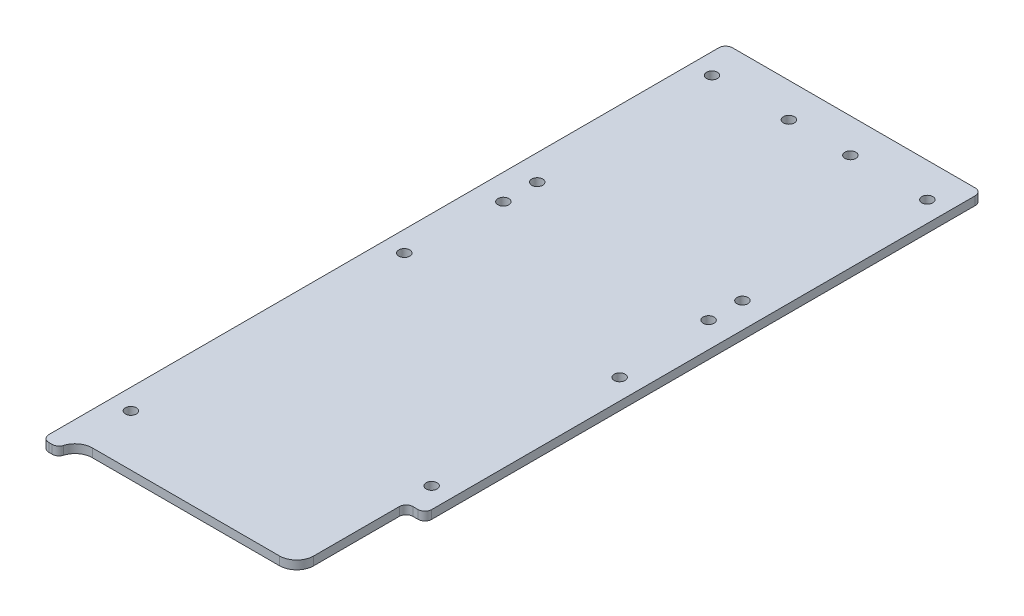
from build123d import *

# Parameters (mm, degrees)
SKETCH1_R           = 2.032
BOSS_EXTRUDE1_DEPTH = 3.175
FILLET1_R           = 2.54
FILLET2_R           = 2.54
FILLET3_R           = 6.35
CUT_EXTRUDE1_DEPTH  = 136.673215063
FILLET4_R           = 6.35
FILLET5_R           = 2.54
SKETCH3_R           = 2.032
CUT_EXTRUDE2_DEPTH  = 136.673215063


with BuildPart() as part:
    # Sketch1 → Boss-Extrude1 (new body)
    with BuildSketch(Plane(origin=(0, 0, 0), x_dir=(1, 0, 0), z_dir=(0, 1, 0))):
        Polygon((47.625, 127), (-47.625, 127), (-47.625, -127), (-41.275, -127), (-41.275, -120.65), (41.275, -120.65), (41.275, -127), (47.625, -127), align=None)
        with Locations((-39.999684148, -101.6)):
            Circle(SKETCH1_R, mode=Mode.SUBTRACT)
        with Locations((39.999684148, -69.85)):
            Circle(SKETCH1_R, mode=Mode.SUBTRACT)
        with Locations((-39.999684148, 0)):
            Circle(SKETCH1_R, mode=Mode.SUBTRACT)
        with Locations((-39.999684148, 114.3)):
            Circle(SKETCH1_R, mode=Mode.SUBTRACT)
        with Locations((-11.424684148, 114.3)):
            Circle(SKETCH1_R, mode=Mode.SUBTRACT)
        with Locations((39.999684148, 0)):
            Circle(SKETCH1_R, mode=Mode.SUBTRACT)
        with Locations((11.424684148, 114.3)):
            Circle(SKETCH1_R, mode=Mode.SUBTRACT)
        with Locations((39.999684148, 114.3)):
            Circle(SKETCH1_R, mode=Mode.SUBTRACT)
    extrude(amount=BOSS_EXTRUDE1_DEPTH)

    # Fillet1
    fillet1_edges = [part.edges().sort_by_distance(p)[0] for p in [
        (-47.625, 1.5875, -127),
        (47.625, 1.5875, -127),
        (47.625, 1.5875, 127),
        (-47.625, 1.5875, 127),
    ]]
    fillet(fillet1_edges, radius=FILLET1_R)

    # Fillet2
    fillet2_edges = [part.edges().sort_by_distance(p)[0] for p in [
        (41.275, 1.5875, 127),
        (-41.275, 1.5875, 127),
    ]]
    fillet(fillet2_edges, radius=FILLET2_R)

    # Fillet3
    fillet3_edges = [part.edges().sort_by_distance(p)[0] for p in [
        (41.275, 1.5875, 120.65),
        (-41.275, 1.5875, 120.65),
    ]]
    fillet(fillet3_edges, radius=FILLET3_R)

    # Sketch2 → Cut-Extrude1 (cut, through all)
    with BuildSketch(Plane.XZ):
        with BuildLine():
            Line((47.625, 131.883089137), (41.910175859, 131.883089137))
            Line((41.910175859, 131.883089137), (41.910175859, 126.140251467))
            ThreePointArc((41.910175859, 126.140251467), (41.593650467, 125.691749265), (41.380880287, 125.185714286))
            ThreePointArc((41.380880287, 125.185714286), (41.06727208, 124.352344029), (40.640175859, 123.571034288))
            Line((40.640175859, 123.571034288), (40.640175859, 79.981419179))
            Line((40.640175859, 79.981419179), (47.625, 79.981419179))
            Line((47.625, 79.981419179), (47.625, 131.883089137))
        make_face()
    extrude(amount=-CUT_EXTRUDE1_DEPTH, mode=Mode.SUBTRACT)

    # Fillet4
    fillet4_edges = [part.edges().sort_by_distance(p)[0] for p in [
        (40.640175859, 1.5875, 123.571034288),
    ]]
    fillet(fillet4_edges, radius=FILLET4_R)

    # Fillet5
    fillet5_edges = [part.edges().sort_by_distance(p)[0] for p in [
        (47.625, 1.5875, 79.981419179),
        (40.640175859, 1.5875, 79.981419179),
    ]]
    fillet(fillet5_edges, radius=FILLET5_R)

    # Sketch3 → Cut-Extrude2 (cut, through all)
    with BuildSketch(Plane.XZ):
        with Locations((-38.113747566, -34.913768806)):
            Circle(SKETCH3_R)
        with Locations((-38.113747566, -47.490173279)):
            Circle(SKETCH3_R)
        with Locations((38.113747566, -47.490173279)):
            Circle(SKETCH3_R)
        with Locations((38.113747566, -34.913768806)):
            Circle(SKETCH3_R)
    extrude(amount=-CUT_EXTRUDE2_DEPTH, mode=Mode.SUBTRACT)


solid = part.part
